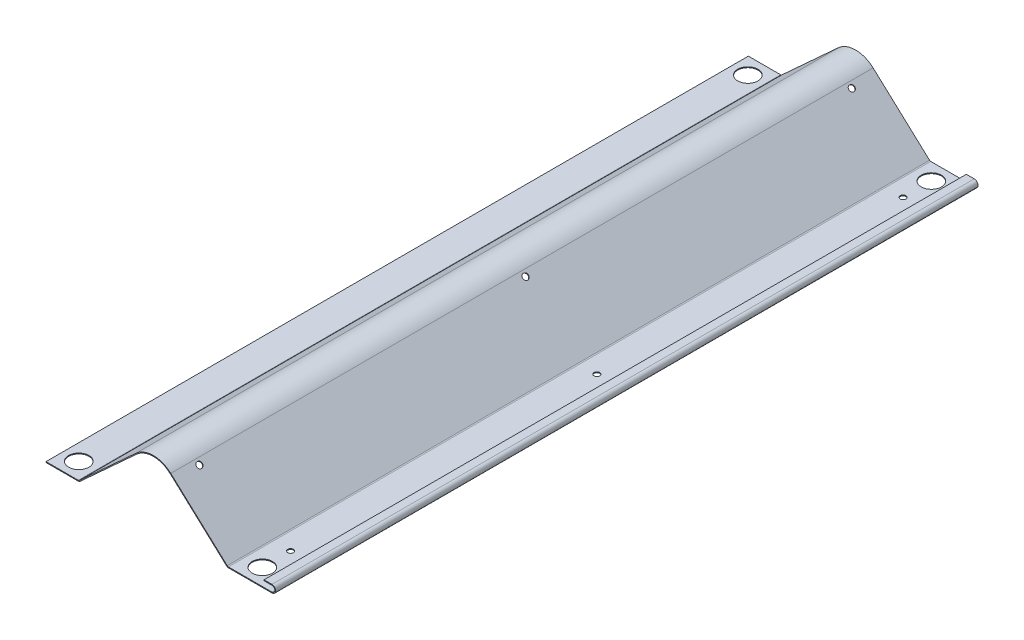
from build123d import *

# Parameters (mm, degrees)
BASE_FLANGE1_DEPTH = 211
SKETCH13_R         = 6.1
EXTRUDE1_DEPTH     = 0.5
SKETCH16_R         = 1.75
EXTRUDE2_DEPTH     = 0.5
SKETCH17_R         = 1.75
EXTRUDE3_DEPTH     = 0.5
SKETCH18_R         = 1.75
EXTRUDE4_DEPTH     = 0.5
HEM1_START         = -211
HEM1_DEPTH         = 422
HEM1_2_DEPTH       = 422


# Read off the part's stored shape, not the designer's step: Hem1
# Sheet-metal steps are written as plain solids
with BuildPart() as part:
    # Sketch1 → Base-Flange1 (new, symmetric)
    with BuildSketch(Plane.XY):
        with BuildLine():
            Line((-64.5, -40.776737244), (-45.083318098, -40.776737244))
            ThreePointArc((-45.083318098, -40.776737244), (-44.53966104, -40.674749048), (-44.069932786, -40.382653249))
            Line((-44.069932786, -40.382653249), (-10.133853114, -9.285965521))
            ThreePointArc((-10.133853114, -9.285965521), (0, -5.345125574), (10.133853114, -9.285965521))
            Line((10.133853114, -9.285965521), (44.069932786, -40.382653249))
            ThreePointArc((44.069932786, -40.382653249), (44.53966104, -40.674749048), (45.083318098, -40.776737244))
            Line((45.083318098, -40.776737244), (73.5, -40.776737244))
            Line((73.5, -40.776737244), (73.5, -40.276737244))
            Line((73.5, -40.276737244), (45.083318098, -40.276737244))
            ThreePointArc((45.083318098, -40.276737244), (44.720880059, -40.208745113), (44.40772789, -40.014014581))
            Line((44.40772789, -40.014014581), (10.471648218, -8.917326853))
            ThreePointArc((10.471648218, -8.917326853), (0, -4.845125574), (-10.471648218, -8.917326853))
            Line((-10.471648218, -8.917326853), (-44.40772789, -40.014014581))
            ThreePointArc((-44.40772789, -40.014014581), (-44.720880059, -40.208745113), (-45.083318098, -40.276737244))
            Line((-45.083318098, -40.276737244), (-64.5, -40.276737244))
            Line((-64.5, -40.276737244), (-64.5, -40.776737244))
        make_face()
    extrude(amount=BASE_FLANGE1_DEPTH, both=True)

    # Sketch13 → Extrude1 (cut)
    with BuildSketch(Plane(origin=(0, -40.276737244, 0), x_dir=(1, 0, 0), z_dir=(0, 1, 0))):
        with Locations(Location((-54.791659049, 201, 0), (0, 0, 180))):
            Circle(SKETCH13_R)
        with Locations(Location((55.5, 201, 0), (0, 0, 180))):
            Circle(SKETCH13_R)
        with Locations((55.5, -201)):
            Circle(SKETCH13_R)
        with Locations((-54.791659049, -201)):
            Circle(SKETCH13_R)
    extrude(amount=-EXTRUDE1_DEPTH, mode=Mode.SUBTRACT)

    # Sketch16 → Extrude2 (cut)
    with BuildSketch(Plane(origin=(0.337795104, 0.368638668, 0), x_dir=(0, 0, -1), z_dir=(0.6755902076156584, 0.7372773368101257, 0))):
        with Locations(Location((-196, -16.74496761, 0), (0, 0, 90))):
            Circle(SKETCH16_R)
        with Locations(Location((196, -16.74496761, 0), (0, 0, 270))):
            Circle(SKETCH16_R)
        with Locations(Location((0, -16.74496761, 0), (0, 0, 90))):
            Circle(SKETCH16_R)
    extrude(amount=-EXTRUDE2_DEPTH, mode=Mode.SUBTRACT)

    # Sketch17 → Extrude3 (cut)
    with BuildSketch(Plane(origin=(0, -40.276737244, 0), x_dir=(1, 0, 0), z_dir=(0, 1, 0))):
        with Locations(Location((55.5, 0, 0), (0, 0, 180))):
            Circle(SKETCH17_R)
    extrude(amount=-EXTRUDE3_DEPTH, mode=Mode.SUBTRACT)

    # Sketch18 → Extrude4 (cut)
    with BuildSketch(Plane(origin=(0, -40.276737244, 0), x_dir=(1, 0, 0), z_dir=(0, 1, 0))):
        with Locations(Location((55.5, -184, 0), (0, 0, 180))):
            Circle(SKETCH18_R)
        with Locations((55.5, 184)):
            Circle(SKETCH18_R)
    extrude(amount=-EXTRUDE4_DEPTH, mode=Mode.SUBTRACT)

    # Hem1 outline → Hem1 (cut)
    with BuildSketch(Plane.XY.offset(HEM1_START)):
        with BuildLine():
            Line((73.5, -40.276737244), (72.664213562, -40.276737244))
            ThreePointArc((72.664213562, -40.276737244), (72, -40.648057588), (71.25, -40.776737244))
            Line((71.25, -40.776737244), (73.5, -40.776737244))
            Line((73.5, -40.776737244), (73.5, -40.276737244))
        make_face()
    extrude(amount=HEM1_DEPTH, mode=Mode.SUBTRACT)

    # Hem1 2 outline → Hem1 2 (add)
    with BuildSketch(Plane.XY.offset(HEM1_START)):
        with BuildLine():
            Line((66.5, -36.276737244), (66.5, -36.776737244))
            Line((66.5, -36.776737244), (71.25, -36.776737244))
            ThreePointArc((71.25, -36.776737244), (73, -38.526737244), (71.25, -40.276737244))
            Line((71.25, -40.276737244), (72.664213562, -40.276737244))
            ThreePointArc((72.664213562, -40.276737244), (73.371320344, -37.776737244), (71.25, -36.276737244))
            Line((71.25, -36.276737244), (66.5, -36.276737244))
        make_face()
    extrude(amount=HEM1_2_DEPTH)


solid = part.part
